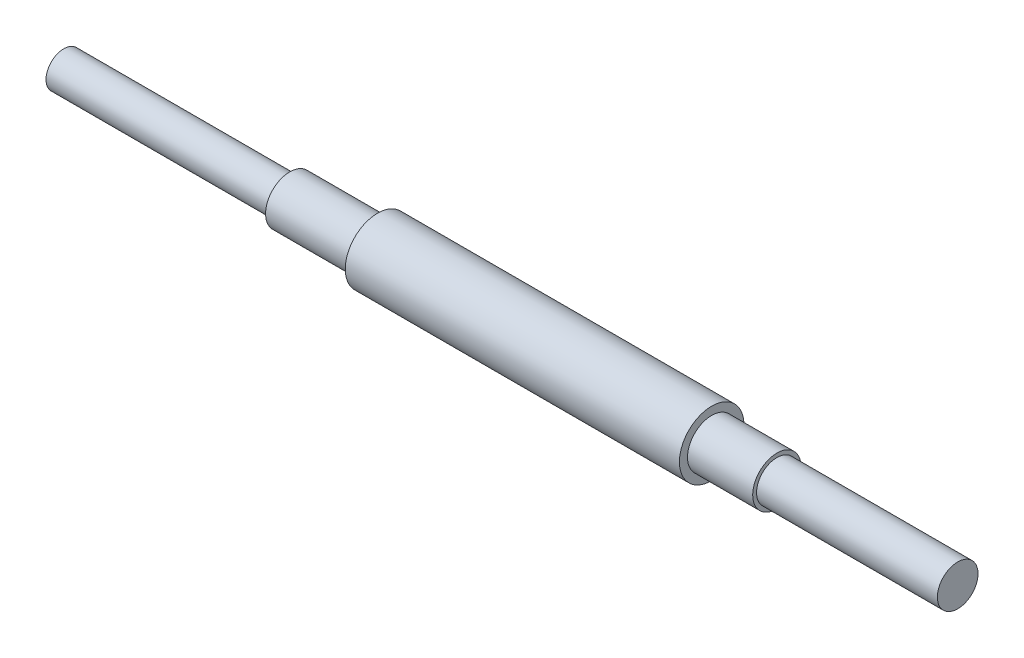
from build123d import *


with BuildPart() as part:
    # Sketch1 → Revolve1 (revolve)
    with BuildSketch(Plane(origin=(0, 0, 0), x_dir=(1, 0, 0), z_dir=(0, 1, 0))):
        Polygon((-78.63058905, 0), (-78.63058905, 3.499993), (-34.18058905, 3.499993), (-34.18058905, 4.7625), (-16.92514985, 4.7625), (-16.92514985, 6.35), (48.79481015, 6.35), (48.79481015, 4.7625), (61.61617135, 4.7625), (61.61617135, 3.99923), (97.17617135, 3.99923), (97.17617135, 0), align=None)
    revolve(axis=Axis((-97.950567047, 0, 0), (1, 0, 0)))


solid = part.part
